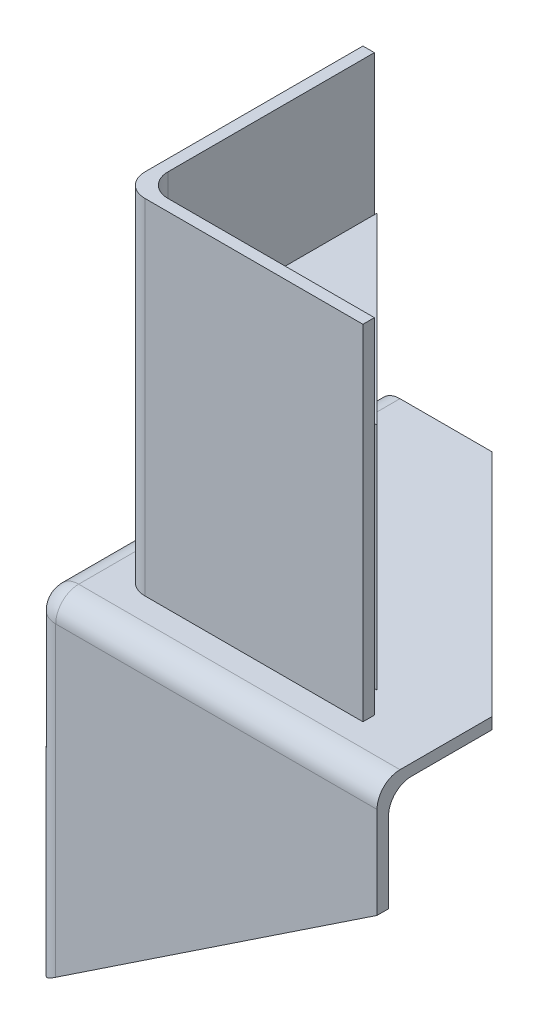
from build123d import *

# Parameters (mm, degrees)
BOSS_EXTRUDE1_DEPTH      = 30
BOSS_EXTRUDE2_DEPTH      = 1
BOSS_EXTRUDE3_DEPTH      = 20
BOSS_EXTRUDE3_DEPTH_BACK = 1
BOSS_EXTRUDE4_DEPTH      = 30
BOSS_EXTRUDE4_DEPTH_BACK = 1
CUT_EXTRUDE1_DEPTH       = 30
CUT_EXTRUDE2_DEPTH       = 30
FILLET2_R                = 2
FILLET3_R                = 2


with BuildPart() as part:
    # Sketch1 → Boss-Extrude1 (new body)
    with BuildSketch(Plane(origin=(0, 0, 0), x_dir=(1, 0, 0), z_dir=(0, 1, 0))):
        Polygon((0, 7), (0, 0), (3.77, 0), (4.77, 0), (5.77, 0), (30, 0), (30, 1), (1, 1), (1, 30), (0, 30), align=None)
    extrude(amount=-BOSS_EXTRUDE1_DEPTH)

    # Sketch1<3> → Boss-Extrude2 (add)
    with BuildSketch(Plane(origin=(0, 0, 0), x_dir=(1, 0, 0), z_dir=(0, 1, 0))):
        Polygon((10, 30), (1, 30), (1, 1), (30, 1), (30, 10), align=None)
        Polygon((4.77, 25), (4.77, 5), (24.77, 5), (24.77, 4), (3.77, 4), (3.77, 25), align=None, mode=Mode.SUBTRACT)
        Polygon((23, 7), (7, 7), (7, 23), align=None, mode=Mode.SUBTRACT)
    extrude(amount=-BOSS_EXTRUDE2_DEPTH)

    # Sketch1<4> → Boss-Extrude3 (add, two sides: drawn at the far end of the back side and taken through both)
    with BuildSketch(Plane(origin=(0, 0, 0), x_dir=(1, 0, 0), z_dir=(0, 1, 0)).offset(-BOSS_EXTRUDE3_DEPTH_BACK)):
        Polygon((7, 23), (7, 7), (23, 7), align=None)
    extrude(amount=BOSS_EXTRUDE3_DEPTH + BOSS_EXTRUDE3_DEPTH_BACK)

    # Sketch1<5> → Boss-Extrude4 (add, two sides: drawn at the far end of the back side and taken through both)
    with BuildSketch(Plane(origin=(0, 0, 0), x_dir=(1, 0, 0), z_dir=(0, 1, 0)).offset(-BOSS_EXTRUDE4_DEPTH_BACK)):
        Polygon((24.77, 5), (4.77, 5), (4.77, 25), (3.77, 25), (3.77, 4), (24.77, 4), align=None)
    extrude(amount=BOSS_EXTRUDE4_DEPTH + BOSS_EXTRUDE4_DEPTH_BACK)

    # Sketch3 → Cut-Extrude1 (cut)
    with BuildSketch(Plane.XY):
        Polygon((30, -10), (0, -30), (30, -30), align=None)
    extrude(amount=-CUT_EXTRUDE1_DEPTH, mode=Mode.SUBTRACT)

    # Sketch4 → Cut-Extrude2 (cut)
    with BuildSketch(Plane(origin=(0, 0, 0), x_dir=(0, 0, -1), z_dir=(1, 0, 0))):
        Polygon((30, -10), (0, -30), (30, -30), align=None)
    extrude(amount=CUT_EXTRUDE2_DEPTH, mode=Mode.SUBTRACT)

    # Fillet2
    fillet2_edges = [part.edges().sort_by_distance(p)[0] for p in [
        (4.77, 15, -5),
        (1, -15.166666667, -1),
        (3.77, 15, -4),
        (0, -15, 0),
    ]]
    fillet(fillet2_edges, radius=FILLET2_R)

    # Fillet3
    fillet3_edges = [part.edges().sort_by_distance(p)[0] for p in [
        (0.585786438, 0, -0.585786438),
        (1.585786438, -1, -1.585786438),
        (0, 0, -16),
        (16, 0, 0),
        (16.5, -1, -1),
        (1, -1, -16.5),
    ]]
    fillet(fillet3_edges, radius=FILLET3_R)


solid = part.part
